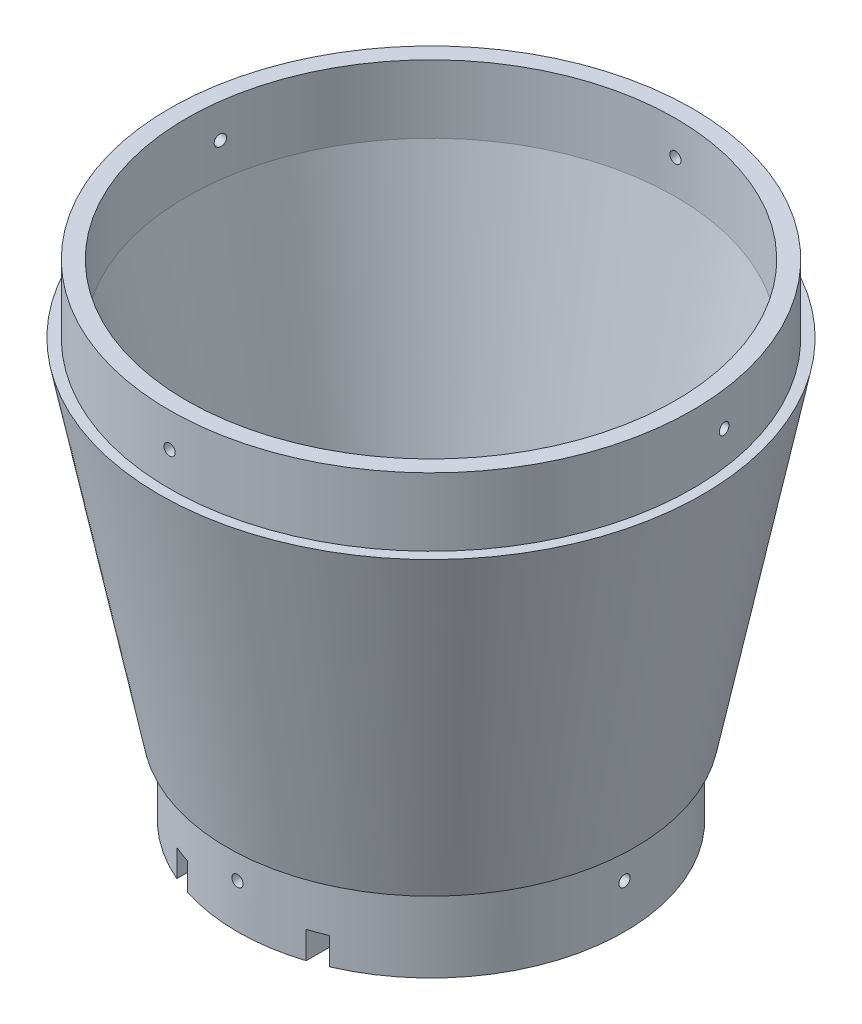
from build123d import *

# Parameters (mm, degrees)
BOSS_EXTRUDE1_REACH             = 166.924
SKETCH3_W                       = 15
SKETCH3_H                       = 10
BOSS_EXTRUDE1_DIRECTION_2_REACH = 166.924
CUT_EXTRUDE1_DEPTH              = 165.924225025
CUT_EXTRUDE1_DEPTH_BACK         = 165.924225025
SKETCH4_W                       = 5
SKETCH4_H                       = 8
M4_TAPPED_HOLE1_REACH           = 226.129
M4_TAPPED_HOLE1_BORE_R          = 1.65
M4_TAPPED_HOLE1_ON_FACE_2_REACH = 222.767
M4_TAPPED_HOLE1_BORE_2_R        = 1.65
M4_TAPPED_HOLE1_ON_FACE_3_REACH = 226.129
M4_TAPPED_HOLE1_BORE_3_R        = 1.65
M4_TAPPED_HOLE1_ON_FACE_4_REACH = 207.107
M4_TAPPED_HOLE1_BORE_4_R        = 1.65
M4_TAPPED_HOLE1_ON_FACE_5_REACH = 207.107
M4_TAPPED_HOLE1_BORE_5_R        = 1.65
M4_TAPPED_HOLE1_ON_FACE_6_REACH = 207.107
M4_TAPPED_HOLE1_BORE_6_R        = 1.65
M4_TAPPED_HOLE1_ON_FACE_7_REACH = 207.107
M4_TAPPED_HOLE1_BORE_7_R        = 1.65
M4_TAPPED_HOLE1_ON_FACE_8_REACH = 222.767
M4_TAPPED_HOLE1_BORE_8_R        = 1.65


with BuildPart() as part:
    # Sketch1 → Revolve1 (revolve)
    with BuildSketch(Plane.XY):
        Polygon((72, 120), (77, 120), (77, 100), (80, 100), (60, 0), (57, 0), (57, -23), (52, -23), (52, 0), (72, 100), align=None)
    revolve(axis=Axis((0, 0, 0), (0, 1, 0)))

    # Sketch3 → Boss-Extrude1 (add, up to next)
    with BuildSketch(Plane.XY, mode=Mode.PRIVATE) as boss_extrude1_sk1:
        with Locations((20, -18)):
            Rectangle(SKETCH3_W, SKETCH3_H)
    boss_extrude1_tool1 = extrude(boss_extrude1_sk1.sketch, amount=BOSS_EXTRUDE1_REACH, mode=Mode.PRIVATE) - part.part
    # Sketch3 → Boss-Extrude1 (add, up to next)
    with BuildSketch(Plane.XY, mode=Mode.PRIVATE) as boss_extrude1_sk2:
        with Locations((-20, -18)):
            Rectangle(SKETCH3_W, SKETCH3_H)
    boss_extrude1_tool2 = extrude(boss_extrude1_sk2.sketch, amount=BOSS_EXTRUDE1_REACH, mode=Mode.PRIVATE) - part.part
    add(boss_extrude1_tool1.solids().sort_by_distance((20, -18, 0))[0])
    add(boss_extrude1_tool2.solids().sort_by_distance((-20, -18, 0))[0])

    # Sketch3 → Boss-Extrude1 direction 2 (add, up to next)
    with BuildSketch(Plane.XY, mode=Mode.PRIVATE) as boss_extrude1_direction_2_sk1:
        with Locations((20, -18)):
            Rectangle(SKETCH3_W, SKETCH3_H)
    boss_extrude1_direction_2_tool1 = extrude(boss_extrude1_direction_2_sk1.sketch, amount=-BOSS_EXTRUDE1_DIRECTION_2_REACH, mode=Mode.PRIVATE) - part.part
    # Sketch3 → Boss-Extrude1 direction 2 (add, up to next)
    with BuildSketch(Plane.XY, mode=Mode.PRIVATE) as boss_extrude1_direction_2_sk2:
        with Locations((-20, -18)):
            Rectangle(SKETCH3_W, SKETCH3_H)
    boss_extrude1_direction_2_tool2 = extrude(boss_extrude1_direction_2_sk2.sketch, amount=-BOSS_EXTRUDE1_DIRECTION_2_REACH, mode=Mode.PRIVATE) - part.part
    add(boss_extrude1_direction_2_tool1.solids().sort_by_distance((20, -18, 0))[0])
    add(boss_extrude1_direction_2_tool2.solids().sort_by_distance((-20, -18, 0))[0])

    # Sketch4 → Cut-Extrude1 (cut, two sides: drawn at the far end of the back side and taken through both)
    with BuildSketch(Plane.XY.offset(-CUT_EXTRUDE1_DEPTH_BACK)):
        with Locations((-20, -19)):
            Rectangle(SKETCH4_W, SKETCH4_H)
        with Locations((20, -19)):
            Rectangle(SKETCH4_W, SKETCH4_H)
    extrude(amount=CUT_EXTRUDE1_DEPTH + CUT_EXTRUDE1_DEPTH_BACK, mode=Mode.SUBTRACT)

    # M4 Tapped Hole1 bore (on position points) → M4 Tapped Hole1 (cut, up to next)
    with BuildSketch(Plane(origin=(-76.347887987, 110, -10), x_dir=(0.12987012987, 0, -0.991531012812), z_dir=(-0.991531012812, 0, -0.12987012987)), mode=Mode.PRIVATE) as m4_tapped_hole1_sk1:
        Circle(M4_TAPPED_HOLE1_BORE_R)
    m4_tapped_hole1_tool1 = extrude(m4_tapped_hole1_sk1.sketch, amount=-M4_TAPPED_HOLE1_REACH, mode=Mode.PRIVATE) & part.part
    add(m4_tapped_hole1_tool1.solids().sort_by_distance((-76.347888, 110, -10))[0], mode=Mode.SUBTRACT)

    # M4 Tapped Hole1 bore 2 (on position points) → M4 Tapped Hole1 on face 2 (cut, up to next)
    with BuildSketch(Plane(origin=(0, 110, -77), x_dir=(-1, 0, 0), z_dir=(0, 0, -1)), mode=Mode.PRIVATE) as m4_tapped_hole1_on_face_2_sk1:
        Circle(M4_TAPPED_HOLE1_BORE_2_R)
    m4_tapped_hole1_on_face_2_tool1 = extrude(m4_tapped_hole1_on_face_2_sk1.sketch, amount=-M4_TAPPED_HOLE1_ON_FACE_2_REACH, mode=Mode.PRIVATE) & part.part
    add(m4_tapped_hole1_on_face_2_tool1.solids().sort_by_distance((0, 110, -77))[0], mode=Mode.SUBTRACT)

    # M4 Tapped Hole1 bore 3 (on position points) → M4 Tapped Hole1 on face 3 (cut, up to next)
    with BuildSketch(Plane(origin=(76.347887987, 110, -10), x_dir=(0.12987000384, 0, 0.991531029319), z_dir=(0.991531029319, 0, -0.12987000384)), mode=Mode.PRIVATE) as m4_tapped_hole1_on_face_3_sk1:
        Circle(M4_TAPPED_HOLE1_BORE_3_R)
    m4_tapped_hole1_on_face_3_tool1 = extrude(m4_tapped_hole1_on_face_3_sk1.sketch, amount=-M4_TAPPED_HOLE1_ON_FACE_3_REACH, mode=Mode.PRIVATE) & part.part
    add(m4_tapped_hole1_on_face_3_tool1.solids().sort_by_distance((76.347888, 110, -10))[0], mode=Mode.SUBTRACT)

    # M4 Tapped Hole1 bore 4 (on position points) → M4 Tapped Hole1 on face 4 (cut, up to next)
    with BuildSketch(Plane(origin=(-57, -10, 0), x_dir=(0, 0, -1), z_dir=(-1, 0, 0)), mode=Mode.PRIVATE) as m4_tapped_hole1_on_face_4_sk1:
        Circle(M4_TAPPED_HOLE1_BORE_4_R)
    m4_tapped_hole1_on_face_4_tool1 = extrude(m4_tapped_hole1_on_face_4_sk1.sketch, amount=-M4_TAPPED_HOLE1_ON_FACE_4_REACH, mode=Mode.PRIVATE) & part.part
    add(m4_tapped_hole1_on_face_4_tool1.solids().sort_by_distance((-57, -10, 0))[0], mode=Mode.SUBTRACT)

    # M4 Tapped Hole1 bore 5 (on position points) → M4 Tapped Hole1 on face 5 (cut, up to next)
    with BuildSketch(Plane(origin=(0, -10, 57), x_dir=(1, 0, 0), z_dir=(0, 0, 1)), mode=Mode.PRIVATE) as m4_tapped_hole1_on_face_5_sk1:
        Circle(M4_TAPPED_HOLE1_BORE_5_R)
    m4_tapped_hole1_on_face_5_tool1 = extrude(m4_tapped_hole1_on_face_5_sk1.sketch, amount=-M4_TAPPED_HOLE1_ON_FACE_5_REACH, mode=Mode.PRIVATE) & part.part
    add(m4_tapped_hole1_on_face_5_tool1.solids().sort_by_distance((0, -10, 57))[0], mode=Mode.SUBTRACT)

    # M4 Tapped Hole1 bore 6 (on position points) → M4 Tapped Hole1 on face 6 (cut, up to next)
    with BuildSketch(Plane(origin=(57, -10, 0), x_dir=(0, 0, 1), z_dir=(1, 0, 0)), mode=Mode.PRIVATE) as m4_tapped_hole1_on_face_6_sk1:
        Circle(M4_TAPPED_HOLE1_BORE_6_R)
    m4_tapped_hole1_on_face_6_tool1 = extrude(m4_tapped_hole1_on_face_6_sk1.sketch, amount=-M4_TAPPED_HOLE1_ON_FACE_6_REACH, mode=Mode.PRIVATE) & part.part
    add(m4_tapped_hole1_on_face_6_tool1.solids().sort_by_distance((57, -10, 0))[0], mode=Mode.SUBTRACT)

    # M4 Tapped Hole1 bore 7 (on position points) → M4 Tapped Hole1 on face 7 (cut, up to next)
    with BuildSketch(Plane(origin=(0, -10, -57), x_dir=(-1, 0, 0), z_dir=(0, 0, -1)), mode=Mode.PRIVATE) as m4_tapped_hole1_on_face_7_sk1:
        Circle(M4_TAPPED_HOLE1_BORE_7_R)
    m4_tapped_hole1_on_face_7_tool1 = extrude(m4_tapped_hole1_on_face_7_sk1.sketch, amount=-M4_TAPPED_HOLE1_ON_FACE_7_REACH, mode=Mode.PRIVATE) & part.part
    add(m4_tapped_hole1_on_face_7_tool1.solids().sort_by_distance((0, -10, -57))[0], mode=Mode.SUBTRACT)

    # M4 Tapped Hole1 bore 8 (on position points) → M4 Tapped Hole1 on face 8 (cut, up to next)
    with BuildSketch(Plane(origin=(0, 110, 77), x_dir=(1, 0, 0), z_dir=(0, 0, 1)), mode=Mode.PRIVATE) as m4_tapped_hole1_on_face_8_sk1:
        Circle(M4_TAPPED_HOLE1_BORE_8_R)
    m4_tapped_hole1_on_face_8_tool1 = extrude(m4_tapped_hole1_on_face_8_sk1.sketch, amount=-M4_TAPPED_HOLE1_ON_FACE_8_REACH, mode=Mode.PRIVATE) & part.part
    add(m4_tapped_hole1_on_face_8_tool1.solids().sort_by_distance((0, 110, 77))[0], mode=Mode.SUBTRACT)


solid = part.part
